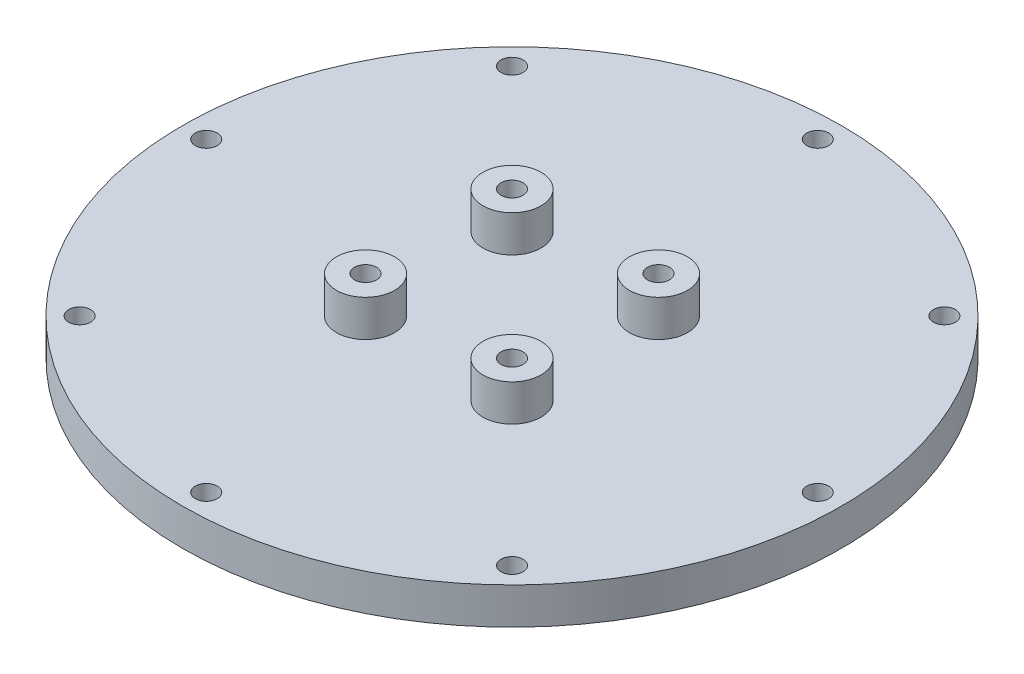
from build123d import *

# Parameters (mm, degrees)
SKETCH1_R           = 45
SKETCH1_R_2         = 1.5
BOSS_EXTRUDE2_DEPTH = 5
SKETCH2_R           = 3.96875
BOSS_EXTRUDE3_DEPTH = 5
SKETCH3_R           = 1.5
CUT_EXTRUDE1_DEPTH  = 7


with BuildPart() as part:
    # Sketch1 → Boss-Extrude2 (new body)
    with BuildSketch(Plane(origin=(0, 0, 0), x_dir=(1, 0, 0), z_dir=(0, 1, 0))):
        Circle(SKETCH1_R)
        with Locations((0, 41.75)):
            Circle(SKETCH1_R_2, mode=Mode.SUBTRACT)
        with Locations((29.521708115, 29.521708115)):
            Circle(SKETCH1_R_2, mode=Mode.SUBTRACT)
        with Locations((41.75, 0)):
            Circle(SKETCH1_R_2, mode=Mode.SUBTRACT)
        with Locations((29.521708115, -29.521708115)):
            Circle(SKETCH1_R_2, mode=Mode.SUBTRACT)
        with Locations((0, -41.75)):
            Circle(SKETCH1_R_2, mode=Mode.SUBTRACT)
        with Locations((-29.521708115, -29.521708115)):
            Circle(SKETCH1_R_2, mode=Mode.SUBTRACT)
        with Locations((-41.75, 0)):
            Circle(SKETCH1_R_2, mode=Mode.SUBTRACT)
        with Locations((-29.521708115, 29.521708115)):
            Circle(SKETCH1_R_2, mode=Mode.SUBTRACT)
    extrude(amount=BOSS_EXTRUDE2_DEPTH)

    # Sketch2 → Boss-Extrude3 (add)
    with BuildSketch(Plane(origin=(0, 5, 0), x_dir=(1, 0, 0), z_dir=(0, 1, 0))):
        with Locations((-10, 10)):
            Circle(SKETCH2_R)
        with Locations((10, 10)):
            Circle(SKETCH2_R)
        with Locations((10, -10)):
            Circle(SKETCH2_R)
        with Locations((-10, -10)):
            Circle(SKETCH2_R)
    extrude(amount=BOSS_EXTRUDE3_DEPTH)

    # Sketch3 → Cut-Extrude1 (cut)
    with BuildSketch(Plane(origin=(0, 10, 0), x_dir=(1, 0, 0), z_dir=(0, 1, 0))):
        with Locations((-10, 10)):
            Circle(SKETCH3_R)
        with Locations((10, 10)):
            Circle(SKETCH3_R)
        with Locations((-10, -10)):
            Circle(SKETCH3_R)
        with Locations((10, -10)):
            Circle(SKETCH3_R)
    extrude(amount=-CUT_EXTRUDE1_DEPTH, mode=Mode.SUBTRACT)


solid = part.part
